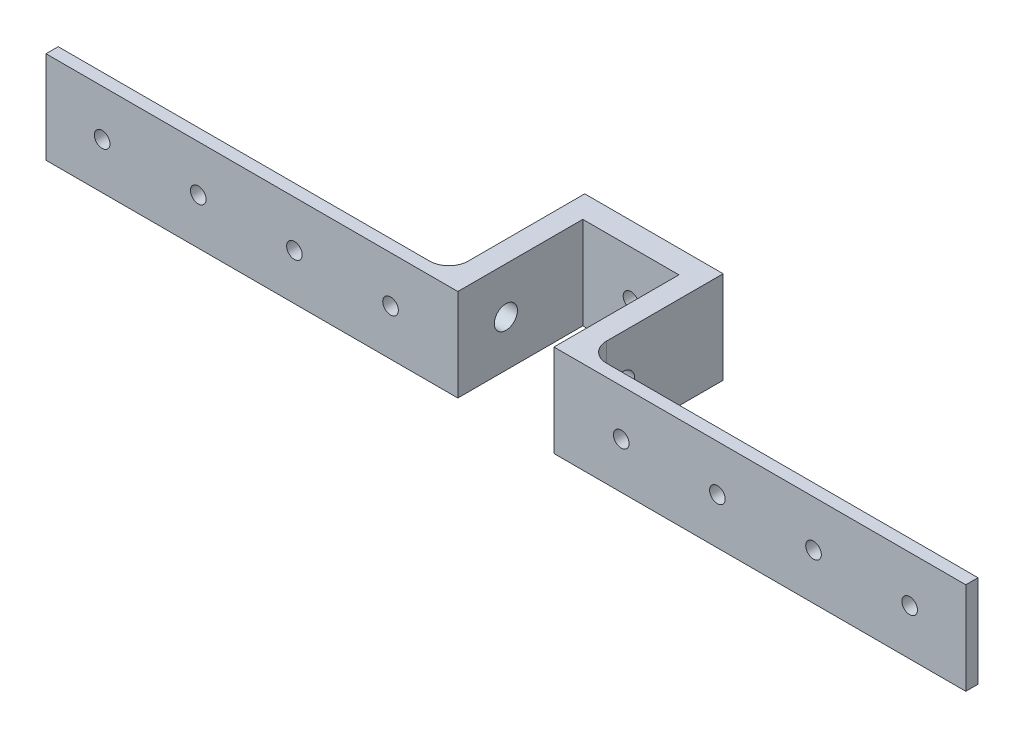
from build123d import *

# Parameters (mm, degrees)
BOSS_EXTRUDE1_DEPTH     = 24
SKETCH2_R               = 2
CUT_EXTRUDE1_DEPTH      = 24
CUT_EXTRUDE2_DEPTH      = 49.705608909
CUT_EXTRUDE2_DEPTH_BACK = 49.705608909
SKETCH3_R               = 3
SKETCH4_W               = 3.175
SKETCH4_H               = 24
BOSS_EXTRUDE2_DEPTH     = 101.6
SKETCH7_R               = 2.032
CUT_EXTRUDE3_DEPTH      = 127.996124449
FILLET1_R               = 5
FILLET2_R               = 5


with BuildPart() as part:
    # Sketch1 → Boss-Extrude1 (new body)
    with BuildSketch(Plane(origin=(0, 0, 0), x_dir=(1, 0, 0), z_dir=(0, 1, 0))):
        Polygon((-18, 22.365963855), (-18, -16.134036145), (-12.5, -16.134036145), (-12.5, 16.365963855), (12.5, 16.365963855), (12.5, -16.134036145), (18, -16.134036145), (18, 22.365963855), align=None)
    extrude(amount=BOSS_EXTRUDE1_DEPTH)

    # Sketch2 → Cut-Extrude1 (cut)
    with BuildSketch(Plane(origin=(0, 0, -22.365963855), x_dir=(-1, 0, 0), z_dir=(0, 0, -1))):
        with Locations((0, 12)):
            Circle(SKETCH2_R)
    extrude(amount=-CUT_EXTRUDE1_DEPTH, mode=Mode.SUBTRACT)

    # Sketch3 → Cut-Extrude2 (cut, two sides: drawn at the far end of the back side and taken through both)
    with BuildSketch(Plane.ZY.offset(18).offset(-CUT_EXTRUDE2_DEPTH_BACK)):
        with Locations((3.634036145, 12)):
            Circle(SKETCH3_R)
    extrude(amount=CUT_EXTRUDE2_DEPTH + CUT_EXTRUDE2_DEPTH_BACK, mode=Mode.SUBTRACT)

    # Sketch4 → Boss-Extrude2 (add)
    with BuildSketch(Plane.ZY.offset(18)):
        with Locations((14.546536145, 12)):
            Rectangle(SKETCH4_W, SKETCH4_H)
    boss_extrude2 = extrude(amount=BOSS_EXTRUDE2_DEPTH)

    # Sketch7 → Cut-Extrude3 (cut, through all)
    with BuildSketch(Plane(origin=(0, 0, 12.959036145), x_dir=(-1, 0, 0), z_dir=(0, 0, -1))):
        with Locations((30, 12)):
            Circle(SKETCH7_R)
        with Locations((55, 12)):
            Circle(SKETCH7_R)
        with Locations((80, 12)):
            Circle(SKETCH7_R)
        with Locations((105, 12)):
            Circle(SKETCH7_R)
        with Locations((130, 12)):
            Circle(SKETCH7_R)
        with Locations((155, 12)):
            Circle(SKETCH7_R)
    cut_extrude3 = extrude(amount=-CUT_EXTRUDE3_DEPTH, mode=Mode.SUBTRACT)

    # Mirror1: Boss-Extrude2, Cut-Extrude3 across plane
    add(boss_extrude2.mirror(Plane.ZY))
    add(cut_extrude3.mirror(Plane.ZY), mode=Mode.SUBTRACT)

    # Fillet1
    fillet1_edges = [part.edges().sort_by_distance(p)[0] for p in [
        (-18, 12, 12.959036145),
    ]]
    fillet(fillet1_edges, radius=FILLET1_R)

    # Fillet2
    fillet2_edges = [part.edges().sort_by_distance(p)[0] for p in [
        (18, 12, 12.959036145),
    ]]
    fillet(fillet2_edges, radius=FILLET2_R)


solid = part.part
